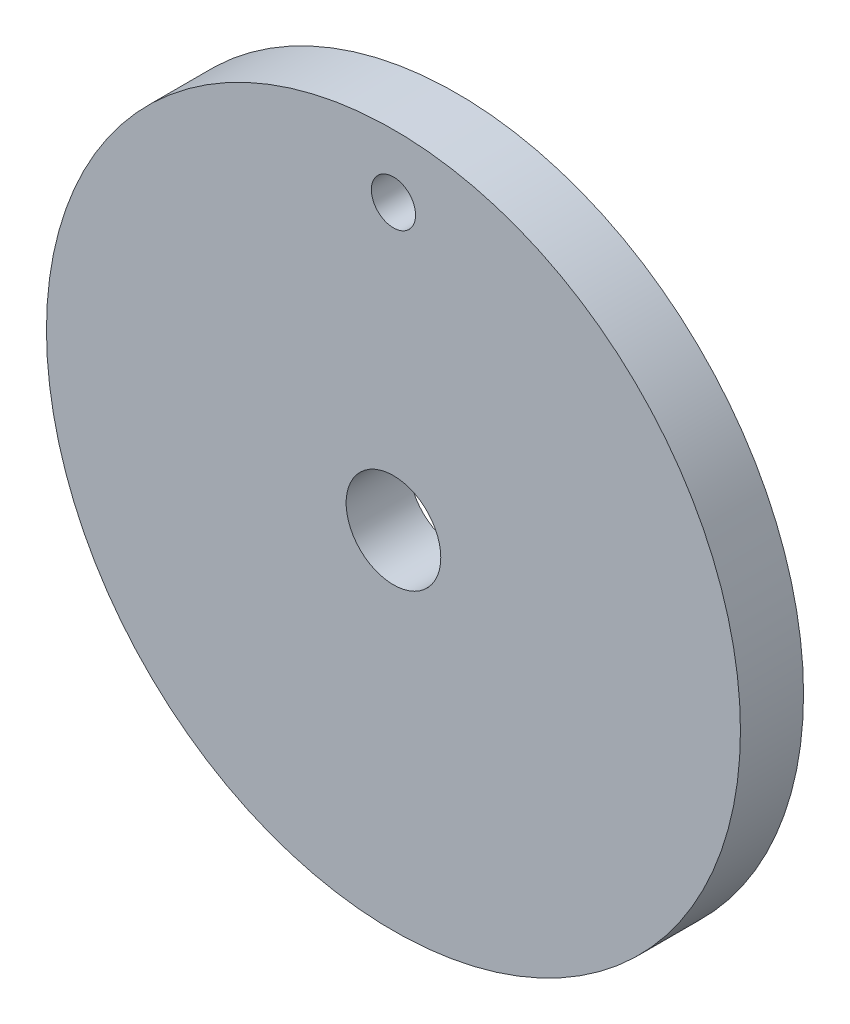
from build123d import *

# Parameters (mm, degrees)
SKETCH1_R           = 11
SKETCH1_R_2         = 1.5
SKETCH1_R_3         = 0.7
BOSS_EXTRUDE1_DEPTH = 2


with BuildPart() as part:
    # Sketch1 → Boss-Extrude1 (new body)
    with BuildSketch(Plane.XY):
        Circle(SKETCH1_R)
        Circle(SKETCH1_R_2, mode=Mode.SUBTRACT)
        with Locations((0, 9)):
            Circle(SKETCH1_R_3, mode=Mode.SUBTRACT)
    extrude(amount=BOSS_EXTRUDE1_DEPTH)


solid = part.part
